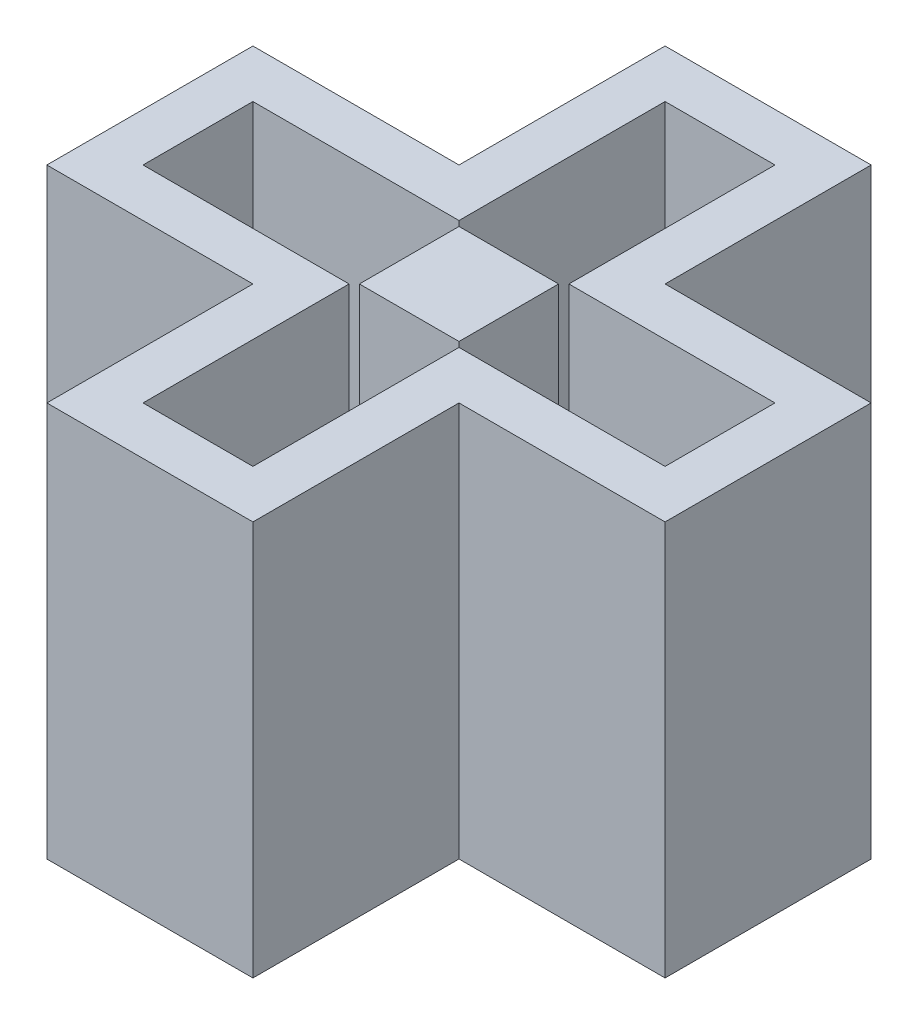
from build123d import *

# Parameters (mm, degrees)
BOSS_EXTRUDE1_DEPTH = 1.5
BOSS_EXTRUDE5_DEPTH = 10
SKETCH2_W           = 2.9
SKETCH2_H           = 2.9
BOSS_EXTRUDE2_DEPTH = 10


with BuildPart() as part:
    # Sketch1 → Boss-Extrude1 (new body)
    with BuildSketch(Plane(origin=(0, 0, 0), x_dir=(1, 0, 0), z_dir=(0, 1, 0))):
        Polygon((-3, 3), (-3, 9), (3, 9), (3, 3), (9, 3), (9, -3), (3, -3), (3, -9), (-3, -9), (-3, -3), (-9, -3), (-9, 3), align=None)
    extrude(amount=BOSS_EXTRUDE1_DEPTH)

    # Sketch3 → Boss-Extrude5 (add)
    with BuildSketch(Plane(origin=(0, 1.5, 0), x_dir=(1, 0, 0), z_dir=(0, 1, 0))):
        Polygon((-3, 3), (-9, 3), (-9, -3), (-3, -3), (-3, -9), (3, -9), (3, -3), (9, -3), (9, 3), (3, 3), (3, 9), (-3, 9), align=None)
        Polygon((-1.6, 1.6), (-7.6, 1.6), (-7.6, -1.6), (-1.6, -1.6), (-1.6, -7.6), (1.6, -7.6), (1.6, -1.6), (7.6, -1.6), (7.6, 1.6), (1.6, 1.6), (1.6, 7.6), (-1.6, 7.6), align=None, mode=Mode.SUBTRACT)
    extrude(amount=BOSS_EXTRUDE5_DEPTH)

    # Sketch2 → Boss-Extrude2 (add)
    with BuildSketch(Plane(origin=(0, 1.5, 0), x_dir=(1, 0, 0), z_dir=(0, 1, 0))):
        Rectangle(SKETCH2_W, SKETCH2_H)
    extrude(amount=BOSS_EXTRUDE2_DEPTH)


solid = part.part
